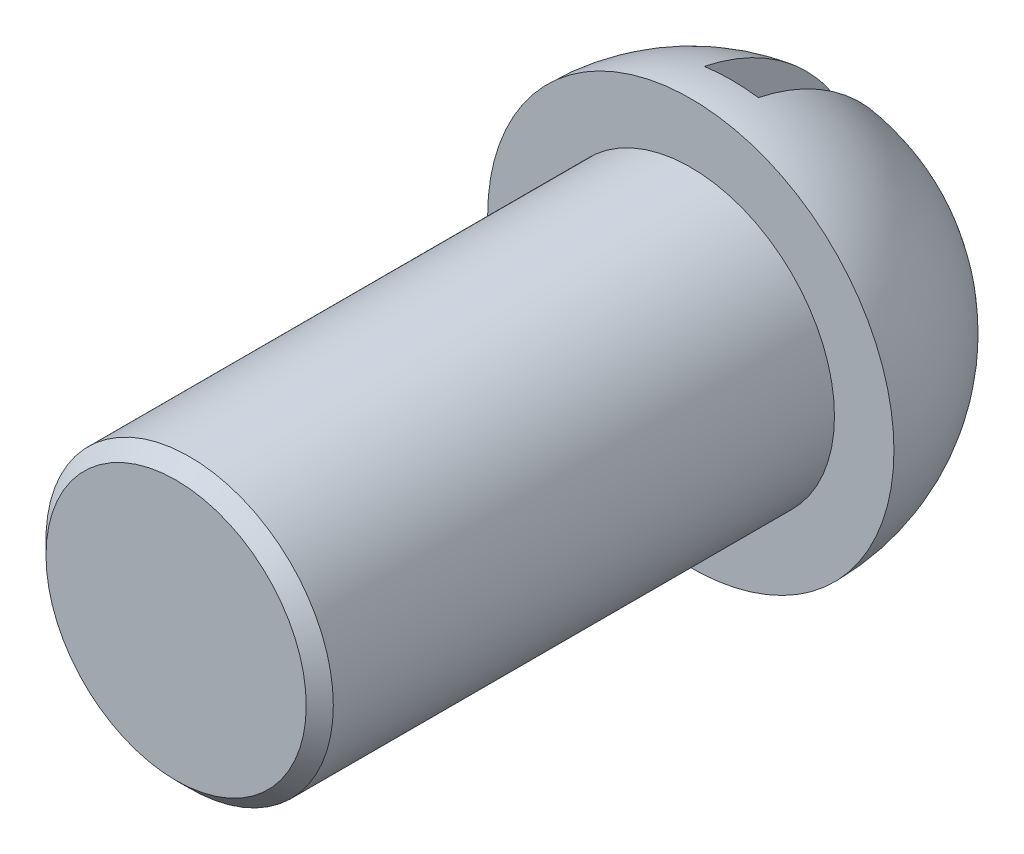
from build123d import *
from OCP.BRepAlgoAPI import BRepAlgoAPI_Cut
from OCP.TopTools import TopTools_ListOfShape

# Parameters (mm, degrees)
CUT_EXTRUDE2_DEPTH      = 17.000000000000007
CUT_EXTRUDE2_DEPTH_BACK = 17.000000000000004
SKETCH4_R               = 1.9934980389772232
CUT_EXTRUDE3_DEPTH      = 5.000000000000005
CHAMFER1_SIZE           = 1


with BuildPart() as part:
    # Sketch1 → Revolve1 (revolve)
    with BuildSketch(Plane(origin=(0, 0, 0), x_dir=(1, 0, 0), z_dir=(0, 1, 0))):
        with BuildLine():
            Line((0, 0), (0, 38))
            Line((0, 38), (0, 53))
            ThreePointArc((0, 53), (10.60660171779814, 48.60660171779814), (15, 38))
            Line((15, 38), (10.60660171779814, 38))
            Line((10.60660171779814, 38), (10.606601717798139, -3.47e-15))
            Line((10.606601717798139, -3.47e-15), (0, 0))
        make_face()
    revolve(axis=Axis((0, 0, 0), (0, 0, -1)))


with BuildPart() as cut_extrude2_tool:
    # Sketch3 → Cut-Extrude2 (new, two sides: drawn at the far end of the back side and taken through both)
    with BuildSketch(Plane(origin=(0, 0, 0), x_dir=(1, 0, 0), z_dir=(0, 1, 0)).offset(-CUT_EXTRUDE2_DEPTH_BACK)):
        Polygon((-2.0023692524081933, 52.866942038246904), (1.9934980389762682, 52.866942038246904), (1.9934980389762682, 41), (-2.0023692524081937, 41), align=None)
    extrude(amount=CUT_EXTRUDE2_DEPTH + CUT_EXTRUDE2_DEPTH_BACK)


with BuildPart() as part_1:
    add(part.part)

    # Cut-Extrude2: cut by cut_extrude2_tool, with a tolerance
    cut_extrude2_stock = TopTools_ListOfShape()
    cut_extrude2_stock.Append(part_1.part.wrapped)
    cut_extrude2_tools = TopTools_ListOfShape()
    cut_extrude2_tools.Append(cut_extrude2_tool.part.wrapped)
    cut_extrude2_cut = BRepAlgoAPI_Cut()
    cut_extrude2_cut.SetArguments(cut_extrude2_stock)
    cut_extrude2_cut.SetTools(cut_extrude2_tools)
    cut_extrude2_cut.SetFuzzyValue(0.00001)
    cut_extrude2_cut.Build()
    add(Compound.cast(cut_extrude2_cut.Shape()).solids(), mode=Mode.REPLACE)


with BuildPart() as cut_extrude2_piece_1:
    # of the separate pieces the step leaves, piece 1, a body of its own (cut_extrude2_pieces)
    add(part_1.part.solids().sort_by_distance((1.993498039, 14.561111413, -41))[0])

    # Chamfer1
    chamfer1_edges = [cut_extrude2_piece_1.edges().sort_by_distance(p)[0] for p in [
        (-10.606601717798139, -1.3e-15, 3.47e-15),
    ]]
    chamfer(chamfer1_edges, length=CHAMFER1_SIZE)


with BuildPart() as cut_extrude2_piece_2:
    # of the separate pieces the step leaves, piece 2, a body of its own (cut_extrude2_pieces)
    add(part_1.part.solids().sort_by_distance((0, 0, -53))[0])

    # Sketch4 → Cut-Extrude3 (cut)
    with BuildSketch(Plane.XY.offset(-52.866942038246904)):
        Circle(SKETCH4_R)
    extrude(amount=-CUT_EXTRUDE3_DEPTH, mode=Mode.SUBTRACT)


solid = cut_extrude2_piece_1.part
